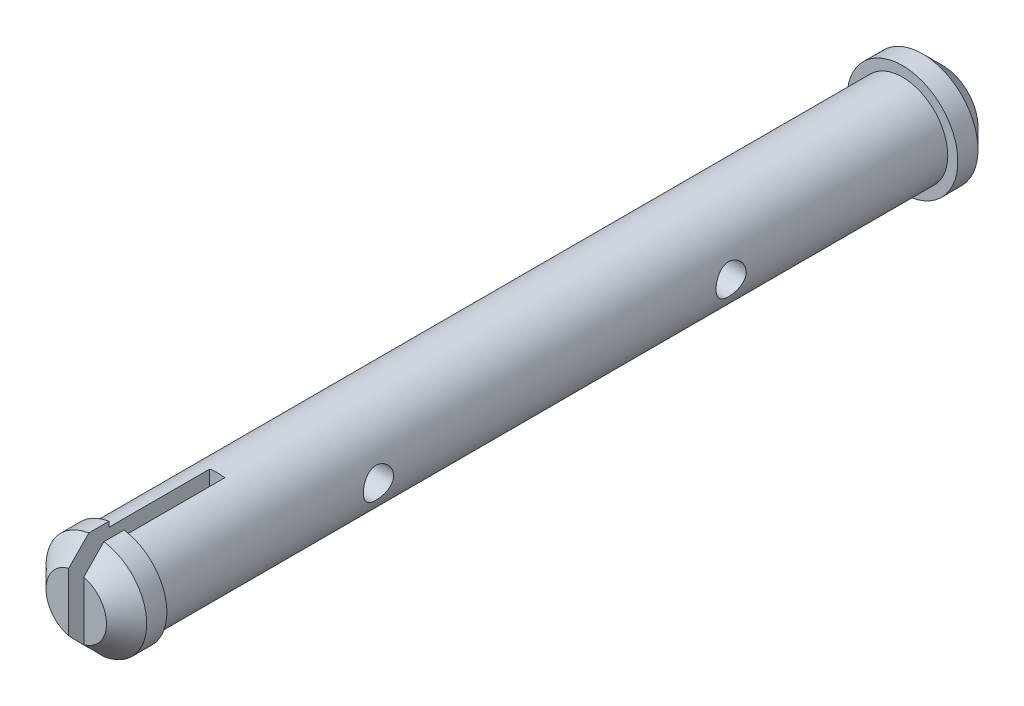
from build123d import *

# Parameters (mm, degrees)
CROQUIS1_R                 = 4.5
SALIENTE_EXTRUIR1_DEPTH    = 78
CROQUIS2_R                 = 5.5
SALIENTE_EXTRUIR2_DEPTH    = 4
CROQUIS3_R                 = 5
SALIENTE_EXTRUIR3_DEPTH    = 4
CROQUIS4_W                 = 1.5
CROQUIS4_H                 = 10.362879212
CORTAR_EXTRUIR1_DEPTH      = 14
CHAFL_N1_SIZE              = 2
CORTAR_EXTRUIR2_DEPTH      = 83.36807634
CORTAR_EXTRUIR2_DEPTH_BACK = 83.36807634
CROQUIS5_R                 = 1.5


with BuildPart() as part:
    # Croquis1 → Saliente-Extruir1 (new body)
    with BuildSketch(Plane.XY):
        Circle(CROQUIS1_R)
    extrude(amount=SALIENTE_EXTRUIR1_DEPTH)

    # Croquis2 → Saliente-Extruir2 (add)
    with BuildSketch(Plane(origin=(0, 0, 0), x_dir=(-1, 0, 0), z_dir=(0, 0, -1))):
        Circle(CROQUIS2_R)
    extrude(amount=SALIENTE_EXTRUIR2_DEPTH)

    # Croquis3 → Saliente-Extruir3 (add)
    with BuildSketch(Plane.XY.offset(78)):
        Circle(CROQUIS3_R)
    extrude(amount=SALIENTE_EXTRUIR3_DEPTH)

    # Croquis4 → Cortar-Extruir1 (cut)
    with BuildSketch(Plane.XY.offset(82)):
        with Locations((0, -0.064365709)):
            Rectangle(CROQUIS4_W, CROQUIS4_H)
    extrude(amount=-CORTAR_EXTRUIR1_DEPTH, mode=Mode.SUBTRACT)

    # Chaflán1
    chafl_n1_edges = [part.edges().sort_by_distance(p)[0] for p in [
        (5.5, 0, -4),
        (-5, 0, 82),
        (5, 0, 82),
    ]]
    chamfer(chafl_n1_edges, length=CHAFL_N1_SIZE)

    # Croquis5 → Cortar-Extruir2 (cut, two sides: drawn at the far end of the back side and taken through both)
    with BuildSketch(Plane(origin=(0, 0, 0), x_dir=(0, 0, -1), z_dir=(1, 0, 0)).offset(-CORTAR_EXTRUIR2_DEPTH_BACK)):
        with Locations((-21.5, 0)):
            Circle(CROQUIS5_R)
        with Locations((-56.5, 0)):
            Circle(CROQUIS5_R)
    extrude(amount=CORTAR_EXTRUIR2_DEPTH + CORTAR_EXTRUIR2_DEPTH_BACK, mode=Mode.SUBTRACT)


solid = part.part
